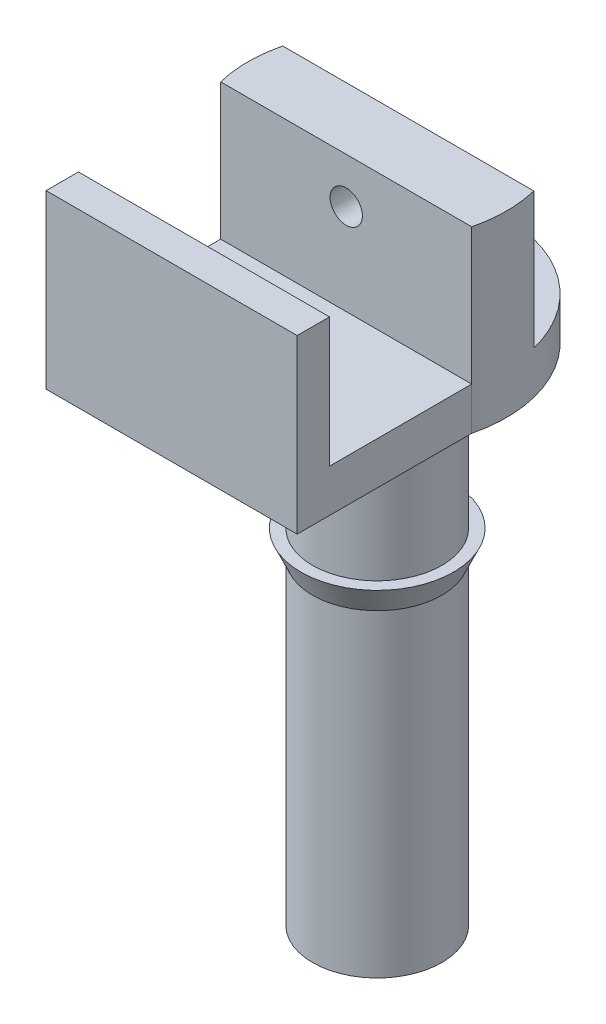
from build123d import *

# Parameters (mm, degrees)
SKETCH1_R                      = 12.7
PART_THAT_GOES_INTO_BASE_DEPTH = 99.06
SKETCH3_R                      = 25.4
BOSS_EXTRUDE2_DEPTH            = 35.14
CUT_EXTRUDE1_START             = -75.457631354
CUT_EXTRUDE1_OUTLINE_W         = 19.304
CUT_EXTRUDE1_OUTLINE_H         = 26.758
CUT_EXTRUDE1_DEPTH             = 49.315262708
BOSS_EXTRUDE3_START            = -8.382
BOSS_EXTRUDE3_DEPTH            = 8.382
BOSS_EXTRUDE4_DEPTH            = 25.4
SKETCH7_R                      = 3.175
CUT_EXTRUDE2_DEPTH             = 12.192


# Read off the part's stored shape, not the designer's step: Cut-Extrude1
with BuildPart() as part:
    # Sketch1 → Part that goes into base (new body)
    with BuildSketch(Plane(origin=(0, 0, 0), x_dir=(1, 0, 0), z_dir=(0, 1, 0))):
        with Locations(Location((0, 0, 0), (0, 0, 270))):
            Circle(SKETCH1_R)
    extrude(amount=PART_THAT_GOES_INTO_BASE_DEPTH)

    # Sketch2 → Clip in mechanism (revolve)
    with BuildSketch(Plane.XY, mode=Mode.PRIVATE) as clip_in_mechanism_sk:
        Polygon((12.7, 62.484), (12.7, 67.564), (14.986, 67.564), align=None)
    revolve(clip_in_mechanism_sk.sketch.rotate(Axis((0, 99.06, 0), (0, -1, 0)), 90), axis=Axis((0, 99.06, 0), (0, -1, 0)))

    # Sketch3 → Boss-Extrude2 (add)
    with BuildSketch(Plane(origin=(0, 99.06, 0), x_dir=(1, 0, 0), z_dir=(0, 1, 0))):
        with Locations(Location((0, 0, 0), (0, 0, 270))):
            Circle(SKETCH3_R)
    extrude(amount=BOSS_EXTRUDE2_DEPTH)

    # Cut-Extrude1 outline → Cut-Extrude1 (cut)
    with BuildSketch(Plane(origin=(50.8, 0, 0), x_dir=(0, 0, -1), z_dir=(1, 0, 0)).offset(CUT_EXTRUDE1_START)):
        with Locations((15.748, 120.821)):
            Rectangle(CUT_EXTRUDE1_OUTLINE_W, CUT_EXTRUDE1_OUTLINE_H)
        with Locations((-15.748, 120.821)):
            Rectangle(CUT_EXTRUDE1_OUTLINE_W, CUT_EXTRUDE1_OUTLINE_H)
    extrude(amount=CUT_EXTRUDE1_DEPTH, mode=Mode.SUBTRACT)

    # Sketch5 → Boss-Extrude3 (add)
    with BuildSketch(Plane(origin=(0, 107.442, 0), x_dir=(1, 0, 0), z_dir=(0, 1, 0)).offset(BOSS_EXTRUDE3_START)):
        with BuildLine():
            Line((24.657631354, -40.386), (24.657631354, -6.096))
            ThreePointArc((24.657631354, -6.096), (0, -25.4), (-24.657631354, -6.096))
            Line((-24.657631354, -6.096), (-24.657631354, -40.386))
            Line((-24.657631354, -40.386), (24.657631354, -40.386))
        make_face()
    extrude(amount=BOSS_EXTRUDE3_DEPTH)

    # Sketch6 → Boss-Extrude4 (add)
    with BuildSketch(Plane(origin=(0, 107.442, 0), x_dir=(1, 0, 0), z_dir=(0, 1, 0))):
        Polygon((5.242487602, -34.036), (-7.020096484, -34.036), (-24.657631354, -34.036), (-24.657631354, -40.386), (24.657631354, -40.386), (24.657631354, -34.036), align=None)
    extrude(amount=BOSS_EXTRUDE4_DEPTH)

    # Sketch7 → Cut-Extrude2 (cut)
    with BuildSketch(Plane(origin=(0, 0, -6.096), x_dir=(-1, 0, 0), z_dir=(0, 0, -1))):
        with Locations(Location((0, 125.31, 0), (0, 0, 90))):
            Circle(SKETCH7_R)
    extrude(amount=-CUT_EXTRUDE2_DEPTH, mode=Mode.SUBTRACT)


solid = part.part
